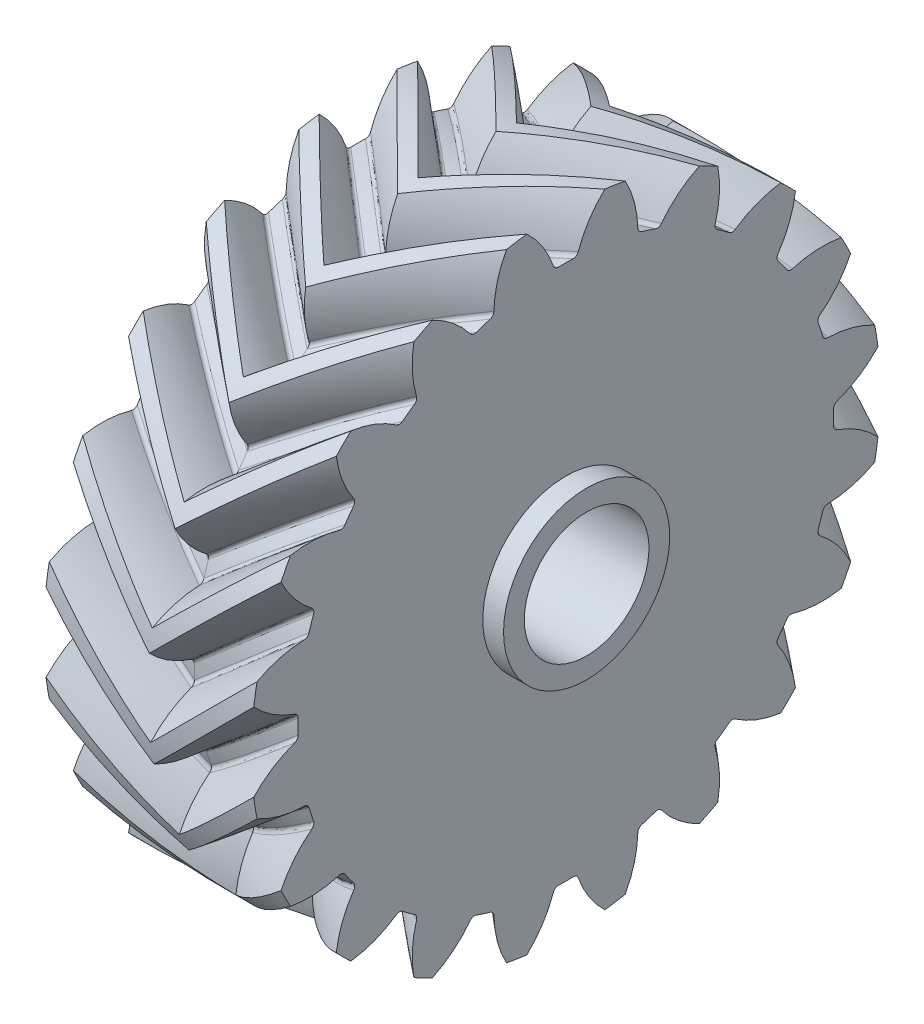
from build123d import *

# Parameters (mm, degrees)
BASPROSKE_W            = 5
BASPROSKE_H            = 15.142135624
TOOTHCUTRH_PITCH       = 95.14084407
TOOTHCUTRH_HEIGHT      = 5
TOOTHCUTRH_RADIUS      = 15.142135624
TOOTHCUTRH_START_ANGLE = -90
TEETHCUTSRH_COUNT      = 20
TEETHCUTSRH_ANGLE      = 342
HUBNEAONESKE_R         = 4
HUBNEARONE_DEPTH       = 1.000002
BORSKE_R               = 3
BORE_DEPTH             = 7.5000025


with BuildPart() as part:
    # BasProSke → Base-Revolve (revolve)
    with BuildSketch(Plane(origin=(0, 0, 0), x_dir=(1, 0, 0), z_dir=(0, 1, 0)), mode=Mode.PRIVATE) as base_revolve_sk:
        with Locations((2.5, 7.571067812)):
            Rectangle(BASPROSKE_W, BASPROSKE_H)
    revolve(base_revolve_sk.sketch.rotate(Axis((-10, 0, 0), (1, 0, 0)), 180), axis=Axis((-10, 0, 0), (1, 0, 0)))

    # ToothCutRH: sweep along a helix
    with BuildLine() as toothcutrh_path:
        add(Helix(TOOTHCUTRH_PITCH, TOOTHCUTRH_HEIGHT, TOOTHCUTRH_RADIUS, center=(0, 0, 0), direction=(1, 0, 0), mode=Mode.PRIVATE).rotate(Axis((0, 0, 0), (1, 0, 0)), TOOTHCUTRH_START_ANGLE))
    # TooCutSkeRH → ToothCutRH (sweep, cut)
    with BuildSketch(Plane(origin=(0, 0, 0), x_dir=(0, 0, -1), z_dir=(1, 0, 0))):
        with BuildLine():
            ThreePointArc((0.354507116, 12.887260595), (0, 12.892135624), (-0.354507116, 12.887260595))
            ThreePointArc((-0.354507116, 12.887260595), (-0.503656114, 12.931364361), (-0.598186363, 13.054873866))
            ThreePointArc((-0.598186363, 13.054873866), (-1.294466274, 14.368281691), (-2.346124634, 15.418929359))
            ThreePointArc((-2.346124634, 15.418929359), (0, 15.596399692), (2.346124634, 15.418929359))
            ThreePointArc((2.346124634, 15.418929359), (1.294466274, 14.368281691), (0.598186363, 13.054873866))
            ThreePointArc((0.598186363, 13.054873866), (0.503656114, 12.931364361), (0.354507116, 12.887260595))
        make_face()
    toothcutrh = sweep(path=toothcutrh_path.line, is_frenet=True, mode=Mode.SUBTRACT)

    # TeethCutsRH: ToothCutRH ×20 about axis
    teethcutsrh_axis = Axis((-10, 0, 0), (1, 0, 0))
    for i in range(1, TEETHCUTSRH_COUNT):
        add(toothcutrh.rotate(teethcutsrh_axis, i * TEETHCUTSRH_ANGLE / (TEETHCUTSRH_COUNT - 1)), mode=Mode.SUBTRACT)

    # HubNeaOneSke → HubNearOne (add)
    with BuildSketch(Plane.ZY):
        with Locations(Location((0, 0, 0), (0, 0, 180))):
            Circle(HUBNEAONESKE_R)
    extrude(amount=HUBNEARONE_DEPTH)

    # BorSke → Bore (cut, symmetric)
    with BuildSketch(Plane(origin=(0, 0, 0), x_dir=(0, 0, -1), z_dir=(1, 0, 0))):
        with Locations(Location((0, 0, 0), (0, 0, 180))):
            Circle(BORSKE_R)
    extrude(amount=BORE_DEPTH, both=True, mode=Mode.SUBTRACT)

    # Symétrie1: part across plane


with BuildPart() as part_1:
    add(part.part)
    add(part.part.mirror(Plane.ZY.offset(-5)))


solid = part_1.part
